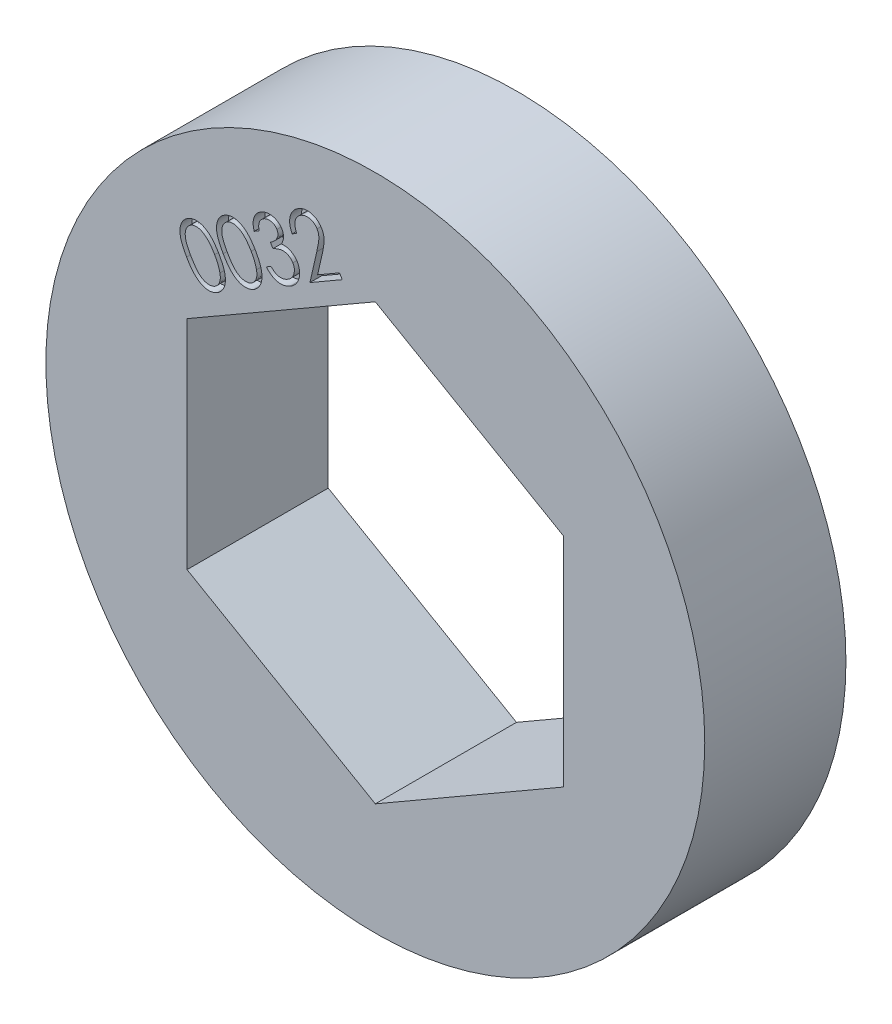
from build123d import *

# Parameters (mm, degrees)
SKETCH2_R           = 11.1125
BOSS_EXTRUDE1_DEPTH = 4.7625
CUT_EXTRUDE1_DEPTH  = 0.4


with BuildPart() as part:
    # Sketch2 → Boss-Extrude1 (new body)
    with BuildSketch(Plane.XY):
        Circle(SKETCH2_R)
        Polygon((0, 7.332348419), (-6.35, 3.666174209), (-6.35, -3.666174209), (0, -7.332348419), (6.35, -3.666174209), (6.35, 3.666174209), align=None, mode=Mode.SUBTRACT)
    extrude(amount=BOSS_EXTRUDE1_DEPTH)

    # Sketch3 → Cut-Extrude1 (cut)
    # profile 1 of 4: a face of its own
    with BuildSketch(Plane.XY.offset(4.7625)):
        with BuildLine():
            add(Edge.make_bspline(
                [(-6.365038057, 5.458747406), (-6.379698789, 5.484490177), (-6.408211771, 5.534556105), (-6.446592929, 5.609228243), (-6.480949907, 5.68034481), (-6.510333699, 5.748279394), (-6.53501277, 5.812851904), (-6.554677632, 5.874195773), (-6.570263658, 5.932186901), (-6.580650181, 5.987409018), (-6.587031451, 6.040226978), (-6.589883206, 6.091025858), (-6.590251775, 6.140247041), (-6.5862527, 6.187820314), (-6.579862116, 6.233886314), (-6.569584367, 6.278202446), (-6.556870702, 6.321190777), (-6.539853239, 6.362121922), (-6.520941172, 6.401609136), (-6.498212363, 6.438312776), (-6.474038026, 6.473396074), (-6.446649211, 6.505623608), (-6.417302653, 6.536073865), (-6.384881, 6.563653045), (-6.350350931, 6.58960647), (-6.325598958, 6.604629946), (-6.313096617, 6.612218376)],
                knots=[0, 0, 0, 0, 1.642146609, 3.193735178, 4.65339879, 6.019959045, 7.29583452, 8.483997703, 9.589852514, 10.622536898, 11.596230804, 12.537100014, 13.442089292, 14.322328697, 15.181380451, 16.017978509, 16.842123126, 17.663296608, 18.472766854, 19.266433458, 20.053886789, 20.832515994, 21.608242113, 22.395755133, 23.189688203, 24, 24, 24, 24], degree=3))
            add(Edge.make_bspline(
                [(-6.313096617, 6.612218376), (-6.300097298, 6.619365468), (-6.274326322, 6.633534481), (-6.23397143, 6.650766042), (-6.193326492, 6.665469162), (-6.151701903, 6.676247132), (-6.109513542, 6.683629142), (-6.066470373, 6.687750339), (-6.022804653, 6.688465055), (-5.978543644, 6.685784838), (-5.933933581, 6.680049518), (-5.889301853, 6.66985018), (-5.84476871, 6.655930609), (-5.799874868, 6.63905645), (-5.755627387, 6.617258167), (-5.711184044, 6.592207272), (-5.666610407, 6.563776491), (-5.622441137, 6.530812514), (-5.577768702, 6.493896836), (-5.53356611, 6.451592863), (-5.489168276, 6.404207544), (-5.445241241, 6.351562941), (-5.401451118, 6.293680762), (-5.357136675, 6.231069516), (-5.313596099, 6.162740436), (-5.285383039, 6.115024216), (-5.270928732, 6.090577918)],
                knots=[0, 0, 0, 0, 0.816106898, 1.617920902, 2.412419145, 3.193416184, 3.981325097, 4.767762218, 5.571164061, 6.382658378, 7.20678923, 8.044113261, 8.898964452, 9.773829128, 10.681145665, 11.610813622, 12.5814274, 13.588962241, 14.6427423, 15.769503862, 16.954284862, 18.215513191, 19.541650863, 20.948716096, 22.436745513, 24, 24, 24, 24], degree=3))
            add(Edge.make_bspline(
                [(-5.270928732, 6.090577918), (-5.25707176, 6.065915876), (-5.23004658, 6.017817628), (-5.192689344, 5.946281157), (-5.160601326, 5.876935245), (-5.13243293, 5.810349123), (-5.109140209, 5.746296723), (-5.089928789, 5.684824066), (-5.07541137, 5.625850623), (-5.06520092, 5.569207613), (-5.059520484, 5.514633712), (-5.056143047, 5.462127843), (-5.057185174, 5.411320239), (-5.06052418, 5.362177574), (-5.068189063, 5.314746736), (-5.078408548, 5.268924072), (-5.092166239, 5.22498129), (-5.109350663, 5.183006367), (-5.129214612, 5.143001122), (-5.152176902, 5.105420305), (-5.176830031, 5.069687586), (-5.20436922, 5.036387792), (-5.235136101, 5.00611551), (-5.267613267, 4.977453804), (-5.30276385, 4.951112706), (-5.327926897, 4.935907949), (-5.340678665, 4.928202701)],
                knots=[0, 0, 0, 0, 1.558572261, 3.039675171, 4.44500239, 5.767404933, 7.021920233, 8.19867626, 9.314183841, 10.366093107, 11.366862767, 12.335955634, 13.262731656, 14.164729598, 15.047477431, 15.907015182, 16.749641984, 17.580952634, 18.403702246, 19.207672054, 20.005351578, 20.794016824, 21.584181799, 22.380929523, 23.179510693, 24, 24, 24, 24], degree=3))
            add(Edge.make_bspline(
                [(-5.340678665, 4.928202701), (-5.353450941, 4.921228662), (-5.378811455, 4.907381074), (-5.418140238, 4.889797882), (-5.458489412, 4.876250404), (-5.499180344, 4.865203268), (-5.540711953, 4.858379189), (-5.582723678, 4.854122268), (-5.625524017, 4.85349799), (-5.668849188, 4.855933227), (-5.712337481, 4.862491203), (-5.755901049, 4.871852543), (-5.799011398, 4.885995088), (-5.842241936, 4.902982739), (-5.885331832, 4.923931061), (-5.928393753, 4.948383307), (-5.971118946, 4.976853692), (-6.01416687, 5.008800721), (-6.056934948, 5.045876579), (-6.100190117, 5.088094615), (-6.143832071, 5.135874962), (-6.187535896, 5.189568622), (-6.231810488, 5.24867481), (-6.276002699, 5.313640809), (-6.321208909, 5.383863572), (-6.35013384, 5.433282962), (-6.365038057, 5.458747406)],
                knots=[0, 0, 0, 0, 0.807491903, 1.603348545, 2.386916451, 3.167713854, 3.940658363, 4.719915701, 5.50935356, 6.313835313, 7.125313705, 7.947948844, 8.783651521, 9.640150085, 10.524255013, 11.440287308, 12.386399569, 13.372019105, 14.413529699, 15.525036669, 16.724996316, 18.002813491, 19.365932914, 20.822335035, 22.362637201, 24, 24, 24, 24], degree=3))
        make_face()
        with BuildLine():
            add(Edge.make_bspline(
                [(-6.21181081, 5.54296674), (-6.199079098, 5.521122802), (-6.174424939, 5.478823391), (-6.136470115, 5.418624931), (-6.099367985, 5.363399364), (-6.063558254, 5.312806176), (-6.028370312, 5.267414065), (-5.993769548, 5.227333857), (-5.960445007, 5.191810531), (-5.927565377, 5.161110332), (-5.894877722, 5.134462318), (-5.862204741, 5.110972915), (-5.829189361, 5.090593286), (-5.796127314, 5.073032865), (-5.762751479, 5.058456392), (-5.729238082, 5.046438628), (-5.695243314, 5.038067421), (-5.650721819, 5.030093628), (-5.596050388, 5.027040599), (-5.532876849, 5.033351819), (-5.47309286, 5.048946021), (-5.436988857, 5.06739506), (-5.418961835, 5.076606814)],
                knots=[0, 0, 0, 0, 1.475228016, 2.856686104, 4.15161897, 5.357081144, 6.47289893, 7.501387829, 8.445726694, 9.313720896, 10.124066195, 10.905058304, 11.660046733, 12.386348828, 13.08755313, 13.783651734, 14.460982071, 15.127735434, 16.421461315, 17.639985157, 18.821625413, 20, 20, 20, 20], degree=3))
            add(Edge.make_bspline(
                [(-5.418961835, 5.076606814), (-5.401787224, 5.087490039), (-5.367499785, 5.109217337), (-5.324384611, 5.153177119), (-5.28750399, 5.203791251), (-5.26330903, 5.251761961), (-5.248158036, 5.293488661), (-5.238848245, 5.326563085), (-5.232591636, 5.361223319), (-5.228775988, 5.397066868), (-5.228372046, 5.434519774), (-5.229588137, 5.473202324), (-5.234249909, 5.513340415), (-5.23911909, 5.540270952), (-5.24161892, 5.554097049)],
                knots=[0, 0, 0, 0, 1.337971097, 2.671129108, 4.032665881, 5.459843453, 6.198285547, 6.96065115, 7.724239053, 8.5201198, 9.33645292, 10.194052936, 11.072829554, 12, 12, 12, 12], degree=3))
            add(Edge.make_bspline(
                [(-5.24161892, 5.554097049), (-5.24512131, 5.571459558), (-5.252249489, 5.606796309), (-5.26706931, 5.659808895), (-5.284488667, 5.71419699), (-5.305185373, 5.769532055), (-5.32924506, 5.82583949), (-5.355861301, 5.883366944), (-5.385917021, 5.942047086), (-5.408053692, 5.98096423), (-5.419332845, 6.00079343)],
                knots=[0, 0, 0, 0, 0.879876913, 1.790754508, 2.73331625, 3.717259664, 4.725112015, 5.77538776, 6.866507818, 8, 8, 8, 8], degree=3))
            add(Edge.make_bspline(
                [(-5.419332845, 6.00079343), (-5.430805174, 6.020426862), (-5.453251787, 6.058841387), (-5.48868481, 6.113514021), (-5.523423421, 6.165010961), (-5.558657333, 6.21258709), (-5.594315019, 6.256188054), (-5.62949714, 6.296606441), (-5.665137813, 6.332929955), (-5.700835951, 6.365717579), (-5.736450676, 6.394974985), (-5.771572592, 6.421131322), (-5.806783639, 6.443468053), (-5.841590459, 6.462958301), (-5.876391186, 6.478801895), (-5.910796289, 6.491684295), (-5.945069635, 6.501051447), (-5.989735785, 6.508665936), (-6.044082139, 6.511800158), (-6.106837724, 6.506077185), (-6.16604376, 6.490337068), (-6.20181271, 6.472128223), (-6.219602026, 6.463072242)],
                knots=[0, 0, 0, 0, 1.327522451, 2.597413504, 3.803087542, 4.954092809, 6.052504639, 7.091116491, 8.08170511, 9.022070092, 9.919800897, 10.771882377, 11.577119672, 12.352806521, 13.099205072, 13.807429758, 14.495830891, 15.170113202, 16.450227669, 17.661618134, 18.837030004, 20, 20, 20, 20], degree=3))
            add(Edge.make_bspline(
                [(-6.219602026, 6.463072242), (-6.236763634, 6.45204528), (-6.270965928, 6.430069053), (-6.314383768, 6.385962878), (-6.351595721, 6.33470668), (-6.375666394, 6.285819834), (-6.39167966, 6.243841508), (-6.400274132, 6.21028835), (-6.407116719, 6.17563749), (-6.411280087, 6.13953304), (-6.412046932, 6.102080315), (-6.411243894, 6.063390682), (-6.406735722, 6.023554749), (-6.400649596, 5.981971531), (-6.390785468, 5.938069409), (-6.376915503, 5.891268672), (-6.358887953, 5.841240121), (-6.337377341, 5.787711595), (-6.311677162, 5.731122289), (-6.282156788, 5.671156368), (-6.248954708, 5.607822223), (-6.224443925, 5.56502492), (-6.21181081, 5.54296674)],
                knots=[0, 0, 0, 0, 1.186584607, 2.364808541, 3.584028067, 4.867913378, 5.52979883, 6.201670858, 6.884946004, 7.589109066, 8.317961587, 9.068444384, 9.84432244, 10.65432116, 11.518850237, 12.466086659, 13.499587148, 14.619373863, 15.830028341, 17.123623296, 18.517485242, 20, 20, 20, 20], degree=3))
        make_face(mode=Mode.SUBTRACT)
    # profile 2 of 4: a face of its own
    with BuildSketch(Plane.XY.offset(4.7625)):
        with BuildLine():
            add(Edge.make_bspline(
                [(-5.131229429, 6.171087149), (-5.145890161, 6.196829921), (-5.174403143, 6.246895849), (-5.212784301, 6.321567986), (-5.247141278, 6.392684553), (-5.276525071, 6.460619137), (-5.301204142, 6.525191648), (-5.320869004, 6.586535516), (-5.33645503, 6.644526644), (-5.346841553, 6.699748762), (-5.353222823, 6.752566721), (-5.356074577, 6.803365602), (-5.356443146, 6.852586784), (-5.352444072, 6.900160057), (-5.346053488, 6.946226057), (-5.335775739, 6.99054219), (-5.323062074, 7.033530521), (-5.306044611, 7.074461666), (-5.287132544, 7.113948879), (-5.264403734, 7.150652519), (-5.240229398, 7.185735817), (-5.212840583, 7.217963351), (-5.183494025, 7.248413609), (-5.151072372, 7.275992788), (-5.116542303, 7.301946214), (-5.09179033, 7.31696969), (-5.079287989, 7.32455812)],
                knots=[0, 0, 0, 0, 1.642146609, 3.193735178, 4.65339879, 6.019959045, 7.29583452, 8.483997703, 9.589852514, 10.622536898, 11.596230804, 12.537100014, 13.442089292, 14.322328697, 15.181380451, 16.017978509, 16.842123126, 17.663296608, 18.472766854, 19.266433458, 20.053886789, 20.832515994, 21.608242113, 22.395755133, 23.189688203, 24, 24, 24, 24], degree=3))
            add(Edge.make_bspline(
                [(-5.079287989, 7.32455812), (-5.066288669, 7.331705212), (-5.040517694, 7.345874225), (-5.000162802, 7.363105785), (-4.959517864, 7.377808906), (-4.917893275, 7.388586876), (-4.875704914, 7.395968885), (-4.832661745, 7.400090083), (-4.788996024, 7.400804799), (-4.744735016, 7.398124581), (-4.700124953, 7.392389261), (-4.655493225, 7.382189923), (-4.610960082, 7.368270353), (-4.56606624, 7.351396193), (-4.521818759, 7.329597911), (-4.477375415, 7.304547015), (-4.432801779, 7.276116235), (-4.388632509, 7.243152257), (-4.343960074, 7.20623658), (-4.299757482, 7.163932607), (-4.255359648, 7.116547288), (-4.211432613, 7.063902685), (-4.167642489, 7.006020505), (-4.123328047, 6.94340926), (-4.07978747, 6.87508018), (-4.05157441, 6.82736396), (-4.037120104, 6.802917662)],
                knots=[0, 0, 0, 0, 0.816106898, 1.617920902, 2.412419145, 3.193416184, 3.981325097, 4.767762218, 5.571164061, 6.382658378, 7.20678923, 8.044113261, 8.898964452, 9.773829128, 10.681145665, 11.610813622, 12.5814274, 13.588962241, 14.6427423, 15.769503862, 16.954284862, 18.215513191, 19.541650863, 20.948716096, 22.436745513, 24, 24, 24, 24], degree=3))
            add(Edge.make_bspline(
                [(-4.037120104, 6.802917662), (-4.023263131, 6.77825562), (-3.996237952, 6.730157372), (-3.958880716, 6.658620901), (-3.926792697, 6.589274989), (-3.898624302, 6.522688866), (-3.875331581, 6.458636467), (-3.85612016, 6.39716381), (-3.841602742, 6.338190367), (-3.831392292, 6.281547356), (-3.825711856, 6.226973456), (-3.822334419, 6.174467587), (-3.823376546, 6.123659983), (-3.826715552, 6.074517318), (-3.834380435, 6.02708648), (-3.84459992, 5.981263816), (-3.858357611, 5.937321033), (-3.875542035, 5.89534611), (-3.895405984, 5.855340866), (-3.918368273, 5.817760048), (-3.943021403, 5.78202733), (-3.970560592, 5.748727536), (-4.001327473, 5.718455254), (-4.033804638, 5.689793547), (-4.068955222, 5.66345245), (-4.094118269, 5.648247693), (-4.106870037, 5.640542445)],
                knots=[0, 0, 0, 0, 1.558572261, 3.039675171, 4.44500239, 5.767404933, 7.021920233, 8.19867626, 9.314183841, 10.366093107, 11.366862767, 12.335955634, 13.262731656, 14.164729598, 15.047477431, 15.907015182, 16.749641984, 17.580952634, 18.403702246, 19.207672054, 20.005351578, 20.794016824, 21.584181799, 22.380929523, 23.179510693, 24, 24, 24, 24], degree=3))
            add(Edge.make_bspline(
                [(-4.106870037, 5.640542445), (-4.119642313, 5.633568406), (-4.145002826, 5.619720818), (-4.18433161, 5.602137626), (-4.224680784, 5.588590147), (-4.265371716, 5.577543011), (-4.306903325, 5.570718933), (-4.34891505, 5.566462012), (-4.391715389, 5.565837734), (-4.43504056, 5.568272971), (-4.478528853, 5.574830947), (-4.52209242, 5.584192287), (-4.56520277, 5.598334832), (-4.608433308, 5.615322483), (-4.651523204, 5.636270805), (-4.694585125, 5.66072305), (-4.737310318, 5.689193436), (-4.780358242, 5.721140465), (-4.82312632, 5.758216322), (-4.866381489, 5.800434359), (-4.910023443, 5.848214706), (-4.953727267, 5.901908365), (-4.998001859, 5.961014553), (-5.042194071, 6.025980553), (-5.087400281, 6.096203316), (-5.116325212, 6.145622706), (-5.131229429, 6.171087149)],
                knots=[0, 0, 0, 0, 0.807491903, 1.603348545, 2.386916451, 3.167713854, 3.940658363, 4.719915701, 5.50935356, 6.313835313, 7.125313705, 7.947948844, 8.783651521, 9.640150085, 10.524255013, 11.440287308, 12.386399569, 13.372019105, 14.413529699, 15.525036669, 16.724996316, 18.002813491, 19.365932914, 20.822335035, 22.362637201, 24, 24, 24, 24], degree=3))
        make_face()
        with BuildLine():
            add(Edge.make_bspline(
                [(-4.978002182, 6.255306484), (-4.965270469, 6.233462545), (-4.940616311, 6.191163134), (-4.902661486, 6.130964675), (-4.865559357, 6.075739108), (-4.829749626, 6.02514592), (-4.794561683, 5.979753809), (-4.75996092, 5.939673601), (-4.726636379, 5.904150274), (-4.693756749, 5.873450076), (-4.661069094, 5.846802062), (-4.628396113, 5.823312659), (-4.595380733, 5.802933029), (-4.562318686, 5.785372609), (-4.528942851, 5.770796135), (-4.495429454, 5.758778371), (-4.461434686, 5.750407165), (-4.416913191, 5.742433372), (-4.36224176, 5.739380342), (-4.299068221, 5.745691563), (-4.239284232, 5.761285765), (-4.203180229, 5.779734803), (-4.185153207, 5.788946558)],
                knots=[0, 0, 0, 0, 1.475228016, 2.856686104, 4.15161897, 5.357081144, 6.47289893, 7.501387829, 8.445726694, 9.313720896, 10.124066195, 10.905058304, 11.660046733, 12.386348828, 13.08755313, 13.783651734, 14.460982071, 15.127735434, 16.421461315, 17.639985157, 18.821625413, 20, 20, 20, 20], degree=3))
            add(Edge.make_bspline(
                [(-4.185153207, 5.788946558), (-4.167978596, 5.799829782), (-4.133691157, 5.821557081), (-4.090575983, 5.865516863), (-4.053695362, 5.916130995), (-4.029500402, 5.964101704), (-4.014349408, 6.005828404), (-4.005039617, 6.038902828), (-3.998783008, 6.073563062), (-3.99496736, 6.109406611), (-3.994563418, 6.146859517), (-3.995779508, 6.185542068), (-4.000441281, 6.225680159), (-4.005310462, 6.252610696), (-4.007810292, 6.266436792)],
                knots=[0, 0, 0, 0, 1.337971097, 2.671129108, 4.032665881, 5.459843453, 6.198285547, 6.96065115, 7.724239053, 8.5201198, 9.33645292, 10.194052936, 11.072829554, 12, 12, 12, 12], degree=3))
            add(Edge.make_bspline(
                [(-4.007810292, 6.266436792), (-4.011312682, 6.283799301), (-4.018440861, 6.319136053), (-4.033260682, 6.372148639), (-4.050680039, 6.426536733), (-4.071376745, 6.481871799), (-4.095436432, 6.538179234), (-4.122052673, 6.595706688), (-4.152108393, 6.654386829), (-4.174245064, 6.693303974), (-4.185524217, 6.713133173)],
                knots=[0, 0, 0, 0, 0.879876913, 1.790754508, 2.73331625, 3.717259664, 4.725112015, 5.77538776, 6.866507818, 8, 8, 8, 8], degree=3))
            add(Edge.make_bspline(
                [(-4.185524217, 6.713133173), (-4.196996546, 6.732766606), (-4.219443158, 6.771181131), (-4.254876182, 6.825853764), (-4.289614793, 6.877350705), (-4.324848705, 6.924926834), (-4.360506391, 6.968527798), (-4.395688512, 7.008946184), (-4.431329185, 7.045269699), (-4.467027322, 7.078057322), (-4.502642048, 7.107314728), (-4.537763963, 7.133471065), (-4.57297501, 7.155807796), (-4.607781831, 7.175298044), (-4.642582558, 7.191141639), (-4.676987661, 7.204024038), (-4.711261007, 7.213391191), (-4.755927157, 7.22100568), (-4.810273511, 7.224139902), (-4.873029096, 7.218416928), (-4.932235132, 7.202676812), (-4.968004081, 7.184467967), (-4.985793398, 7.175411986)],
                knots=[0, 0, 0, 0, 1.327522451, 2.597413504, 3.803087542, 4.954092809, 6.052504639, 7.091116491, 8.08170511, 9.022070092, 9.919800897, 10.771882377, 11.577119672, 12.352806521, 13.099205072, 13.807429758, 14.495830891, 15.170113202, 16.450227669, 17.661618134, 18.837030004, 20, 20, 20, 20], degree=3))
            add(Edge.make_bspline(
                [(-4.985793398, 7.175411986), (-5.002955005, 7.164385024), (-5.0371573, 7.142408796), (-5.08057514, 7.098302622), (-5.117787093, 7.047046423), (-5.141857766, 6.998159577), (-5.157871032, 6.956181251), (-5.166465504, 6.922628093), (-5.173308091, 6.887977233), (-5.177471459, 6.851872783), (-5.178238304, 6.814420059), (-5.177435266, 6.775730426), (-5.172927093, 6.735894492), (-5.166840968, 6.694311274), (-5.15697684, 6.650409153), (-5.143106875, 6.603608415), (-5.125079325, 6.553579865), (-5.103568713, 6.500051339), (-5.077868534, 6.443462033), (-5.04834816, 6.383496111), (-5.01514608, 6.320161967), (-4.990635297, 6.277364663), (-4.978002182, 6.255306484)],
                knots=[0, 0, 0, 0, 1.186584607, 2.364808541, 3.584028067, 4.867913378, 5.52979883, 6.201670858, 6.884946004, 7.589109066, 8.317961587, 9.068444384, 9.84432244, 10.65432116, 11.518850237, 12.466086659, 13.499587148, 14.619373863, 15.830028341, 17.123623296, 18.517485242, 20, 20, 20, 20], degree=3))
        make_face(mode=Mode.SUBTRACT)
    # profile 3 of 4: a face of its own
    with BuildSketch(Plane.XY.offset(4.7625)):
        with BuildLine():
            Line((-3.921536469, 7.443652421), (-4.085152004, 7.349044798))
            add(Edge.make_bspline(
                [(-4.085152004, 7.349044798), (-4.090485084, 7.367405392), (-4.100961864, 7.403474588), (-4.111907579, 7.457694086), (-4.119305718, 7.510476969), (-4.121601958, 7.561848626), (-4.121043165, 7.611785962), (-4.114604819, 7.660240406), (-4.105342673, 7.707551518), (-4.090965914, 7.753122002), (-4.073396047, 7.796958502), (-4.051639865, 7.83810018), (-4.027122339, 7.87716258), (-3.998795566, 7.913340604), (-3.967556287, 7.94752795), (-3.932486057, 7.978476099), (-3.89443136, 8.007509223), (-3.866912852, 8.024277711), (-3.852899567, 8.03281675)],
                knots=[0, 0, 0, 0, 1.167122436, 2.292799985, 3.374788507, 4.418350268, 5.430616342, 6.419827689, 7.398867449, 8.371125697, 9.333210978, 10.279063296, 11.209319313, 12.145930279, 13.081231023, 14.033304242, 14.998496994, 16, 16, 16, 16], degree=3))
            add(Edge.make_bspline(
                [(-3.852899567, 8.03281675), (-3.832014619, 8.044029042), (-3.790629926, 8.066246827), (-3.724273581, 8.089258788), (-3.656237051, 8.104906671), (-3.586781076, 8.111223986), (-3.518004199, 8.110102302), (-3.451483222, 8.10002082), (-3.38826048, 8.081416727), (-3.329079214, 8.054305063), (-3.275071162, 8.020272212), (-3.227197001, 7.980644678), (-3.185381303, 7.936022044), (-3.163910288, 7.901863757), (-3.153174173, 7.884783647)],
                knots=[0, 0, 0, 0, 1.074691264, 2.12956096, 3.177038176, 4.237422126, 5.287604453, 6.29289588, 7.282431617, 8.269862499, 9.238778467, 10.171894397, 11.085895465, 12, 12, 12, 12], degree=3))
            add(Edge.make_bspline(
                [(-3.153174173, 7.884783647), (-3.143986692, 7.867583853), (-3.125940342, 7.833799457), (-3.108318596, 7.779720302), (-3.098044565, 7.724842364), (-3.095668127, 7.668817131), (-3.102356666, 7.611897737), (-3.116888468, 7.554203649), (-3.138627113, 7.495237154), (-3.158999737, 7.457278157), (-3.169498625, 7.437716256)],
                knots=[0, 0, 0, 0, 0.993684363, 1.951827249, 2.889052743, 3.836657995, 4.80211292, 5.803367142, 6.867980745, 8, 8, 8, 8], degree=3))
            add(Edge.make_bspline(
                [(-3.169498625, 7.437716256), (-3.146149731, 7.440154296), (-3.1001245, 7.444960149), (-3.031318946, 7.442003808), (-2.964291099, 7.431399175), (-2.921752567, 7.417052658), (-2.90051617, 7.409890485)],
                knots=[0, 0, 0, 0, 1.030179289, 2.030684612, 3.016863995, 4, 4, 4, 4], degree=3))
            add(Edge.make_bspline(
                [(-2.90051617, 7.409890485), (-2.886055666, 7.404083854), (-2.857470036, 7.392605263), (-2.817052871, 7.371169752), (-2.778941947, 7.347463208), (-2.743592662, 7.320730108), (-2.711239944, 7.290960886), (-2.68179223, 7.258266576), (-2.654391267, 7.223203619), (-2.638947889, 7.197596226), (-2.631162704, 7.184687243)],
                knots=[0, 0, 0, 0, 1.043009504, 2.061828929, 3.059211452, 4.046535033, 5.025484809, 5.998847267, 6.991195781, 8, 8, 8, 8], degree=3))
            add(Edge.make_bspline(
                [(-2.631162704, 7.184687243), (-2.618967332, 7.161619769), (-2.594688417, 7.115696346), (-2.570567111, 7.041098146), (-2.555319479, 6.963380981), (-2.552042083, 6.896431162), (-2.553889328, 6.842401879), (-2.55802154, 6.802251292), (-2.564547267, 6.762765665), (-2.574410608, 6.724322979), (-2.586184016, 6.686397617), (-2.601151566, 6.6495927), (-2.618162633, 6.613234334), (-2.644988094, 6.566480251), (-2.683985306, 6.510756471), (-2.74003135, 6.450244767), (-2.804304604, 6.395418941), (-2.852839304, 6.365496953), (-2.877513532, 6.350285116)],
                knots=[0, 0, 0, 0, 1.29000945, 2.568189731, 3.865360559, 5.202453644, 5.87655905, 6.541392666, 7.199849175, 7.856366189, 8.505211772, 9.164806495, 9.822265449, 10.491484855, 11.832065632, 13.180012139, 14.566365457, 16, 16, 16, 16], degree=3))
            add(Edge.make_bspline(
                [(-2.877513532, 6.350285116), (-2.894680918, 6.340842699), (-2.928261449, 6.322372713), (-2.980334158, 6.300026773), (-3.032216262, 6.282606708), (-3.084155817, 6.269648014), (-3.136255638, 6.262344113), (-3.18828424, 6.259699498), (-3.240352459, 6.261885327), (-3.292182948, 6.269308493), (-3.343640661, 6.281980853), (-3.394110522, 6.299965549), (-3.443861576, 6.322562544), (-3.492180933, 6.351176919), (-3.539762816, 6.384589514), (-3.586178005, 6.423414771), (-3.631647438, 6.467351711), (-3.660188799, 6.499600853), (-3.674814631, 6.516126713)],
                knots=[0, 0, 0, 0, 1.049948212, 2.053767481, 3.032934156, 3.981728119, 4.919406159, 5.848819654, 6.771301382, 7.708979423, 8.651334191, 9.607581917, 10.577750219, 11.57619022, 12.613670697, 13.691816969, 14.817186887, 16, 16, 16, 16], degree=3))
            Line((-3.674814631, 6.516126713), (-3.517877281, 6.607024232))
            add(Edge.make_bspline(
                [(-3.517877281, 6.607024232), (-3.507057864, 6.596571804), (-3.486031429, 6.576258574), (-3.454313618, 6.547691181), (-3.422154236, 6.523492896), (-3.39114989, 6.50148186), (-3.359920795, 6.483812519), (-3.329275661, 6.469272361), (-3.299310123, 6.457285986), (-3.278894878, 6.452448334), (-3.268929381, 6.450086882)],
                knots=[0, 0, 0, 0, 1.210652835, 2.352780436, 3.431589675, 4.447423396, 5.410202577, 6.313818959, 7.176907658, 8, 8, 8, 8], degree=3))
            add(Edge.make_bspline(
                [(-3.268929381, 6.450086882), (-3.256472095, 6.447845324), (-3.231567654, 6.443364031), (-3.19375134, 6.441376711), (-3.155701439, 6.442698904), (-3.11775486, 6.448530653), (-3.079402433, 6.457302149), (-3.041360111, 6.470638818), (-3.002766353, 6.4867117), (-2.978055493, 6.500536991), (-2.965442969, 6.507593476)],
                knots=[0, 0, 0, 0, 0.960250092, 1.919719324, 2.868886039, 3.84629253, 4.830262792, 5.851782114, 6.90354087, 8, 8, 8, 8], degree=3))
            add(Edge.make_bspline(
                [(-2.965442969, 6.507593476), (-2.951422516, 6.515995177), (-2.923984097, 6.532437539), (-2.886411131, 6.560994069), (-2.852510546, 6.591165896), (-2.823105634, 6.623851182), (-2.797070011, 6.657902983), (-2.776070523, 6.694665524), (-2.758319926, 6.733039659), (-2.745165355, 6.773314498), (-2.736144668, 6.814117324), (-2.730235567, 6.854551591), (-2.728946796, 6.894198565), (-2.730843213, 6.933166286), (-2.737848298, 6.971150423), (-2.748164334, 7.008493571), (-2.7626958, 7.04502891), (-2.775134989, 7.068300612), (-2.781421869, 7.080062343)],
                knots=[0, 0, 0, 0, 1.167772066, 2.285362462, 3.368423776, 4.407462857, 5.424256643, 6.426647963, 7.427673547, 8.442620435, 9.448631702, 10.412699789, 11.359420925, 12.280485196, 13.196272094, 14.114446078, 15.047023836, 16, 16, 16, 16], degree=3))
            add(Edge.make_bspline(
                [(-2.781421869, 7.080062343), (-2.791007931, 7.095098247), (-2.810068147, 7.124994523), (-2.846431143, 7.164270133), (-2.888253583, 7.19828182), (-2.93536113, 7.226251478), (-2.985838371, 7.24802665), (-3.038699725, 7.262991775), (-3.093401785, 7.268983271), (-3.140107211, 7.268126411), (-3.179108834, 7.263238632), (-3.211085247, 7.256419034), (-3.245379312, 7.24654617), (-3.282374668, 7.234748637), (-3.321697459, 7.219762234), (-3.36345885, 7.201918919), (-3.407720582, 7.181437615), (-3.437776834, 7.166461799), (-3.453321492, 7.158716523)],
                knots=[0, 0, 0, 0, 1.125332271, 2.237527227, 3.365652799, 4.522661347, 5.688745643, 6.832392968, 7.981451294, 9.154302826, 9.776809218, 10.4636777, 11.218577585, 12.031930245, 12.917616271, 13.877381006, 14.902212215, 16, 16, 16, 16], degree=3))
            Line((-3.453321492, 7.158716523), (-3.538282847, 7.306007606))
            add(Edge.make_bspline(
                [(-3.538282847, 7.306007606), (-3.52065904, 7.316978158), (-3.486041287, 7.338527186), (-3.43818984, 7.375129048), (-3.396559022, 7.416096335), (-3.359981771, 7.459058023), (-3.329585732, 7.503274403), (-3.307044781, 7.54787966), (-3.291644577, 7.591502211), (-3.284635951, 7.63443809), (-3.284073091, 7.675898958), (-3.290353833, 7.715696351), (-3.301506602, 7.754105258), (-3.313898665, 7.777614622), (-3.3201288, 7.789434004)],
                knots=[0, 0, 0, 0, 1.266180123, 2.487108066, 3.66629058, 4.822683044, 5.925529858, 6.931065459, 7.864004537, 8.736007996, 9.57354566, 10.382383672, 11.186739966, 12, 12, 12, 12], degree=3))
            add(Edge.make_bspline(
                [(-3.3201288, 7.789434004), (-3.325409574, 7.797830645), (-3.335845099, 7.814423545), (-3.354212279, 7.837229864), (-3.374603817, 7.857632028), (-3.397036475, 7.875695393), (-3.421810676, 7.890920095), (-3.448668853, 7.903925088), (-3.477591, 7.914702866), (-3.508316309, 7.922696646), (-3.539926194, 7.928369539), (-3.572025321, 7.930663235), (-3.60403601, 7.929244579), (-3.636188157, 7.925906895), (-3.668035196, 7.918176717), (-3.699954177, 7.907714155), (-3.731832292, 7.893979556), (-3.752562812, 7.882722505), (-3.763115078, 7.876992431)],
                knots=[0, 0, 0, 0, 0.946865682, 1.871134866, 2.789952873, 3.69761661, 4.615446926, 5.561132897, 6.544151416, 7.558468937, 8.589704286, 9.608072091, 10.624588379, 11.647331576, 12.690339784, 13.747500356, 14.853430691, 16, 16, 16, 16], degree=3))
            add(Edge.make_bspline(
                [(-3.763115078, 7.876992431), (-3.779424198, 7.86659894), (-3.811324371, 7.846269567), (-3.852421147, 7.807936266), (-3.88488659, 7.763781888), (-3.906053026, 7.723325364), (-3.91842831, 7.688175906), (-3.925405945, 7.659462897), (-3.930216385, 7.628557355), (-3.932567232, 7.595564859), (-3.933562411, 7.560498626), (-3.93129579, 7.523363482), (-3.927835604, 7.484083062), (-3.923672216, 7.45736059), (-3.921536469, 7.443652421)],
                knots=[0, 0, 0, 0, 1.400382439, 2.739108122, 4.046622513, 5.35815942, 6.033190176, 6.744421047, 7.497821892, 8.298419774, 9.141582518, 10.039481475, 10.994287596, 12, 12, 12, 12], degree=3))
        make_face()
    # profile 4 of 4: a face of its own
    with BuildSketch(Plane.XY.offset(4.7625)):
        with BuildLine():
            Line((-2.649513782, 8.003877948), (-2.803112039, 7.91520649))
            add(Edge.make_bspline(
                [(-2.803112039, 7.91520649), (-2.813405397, 7.935058069), (-2.833654545, 7.974110198), (-2.856670091, 8.034828281), (-2.874619433, 8.095265643), (-2.885602747, 8.15585938), (-2.890942589, 8.216353686), (-2.890142697, 8.276750441), (-2.883517011, 8.337183042), (-2.870468289, 8.39690883), (-2.852038377, 8.454907714), (-2.828547503, 8.510046857), (-2.80049981, 8.562116659), (-2.76624156, 8.609881117), (-2.728071164, 8.654922902), (-2.684177547, 8.695652519), (-2.63583554, 8.733617546), (-2.600406016, 8.755273957), (-2.582360921, 8.76630408)],
                knots=[0, 0, 0, 0, 1.095282936, 2.154646258, 3.17720595, 4.181928296, 5.167652369, 6.149790891, 7.137898102, 8.142620448, 9.141473397, 10.116570871, 11.076934142, 12.033943277, 12.992621363, 13.966134661, 14.964104222, 16, 16, 16, 16], degree=3))
            add(Edge.make_bspline(
                [(-2.582360921, 8.76630408), (-2.564104957, 8.77629533), (-2.528330819, 8.795874048), (-2.472729644, 8.818862106), (-2.417348084, 8.836047618), (-2.361947242, 8.847518104), (-2.306546991, 8.852214119), (-2.251324399, 8.851159069), (-2.196223616, 8.843993627), (-2.141907733, 8.830911988), (-2.089017906, 8.813405291), (-2.039213731, 8.790778312), (-1.992096824, 8.765139542), (-1.949040443, 8.734316001), (-1.908998983, 8.70009612), (-1.872426102, 8.661586233), (-1.839308983, 8.618888341), (-1.82027395, 8.587911711), (-1.810659532, 8.572265702)],
                knots=[0, 0, 0, 0, 1.123370733, 2.201342023, 3.242939719, 4.25161303, 5.250641824, 6.239413307, 7.22946995, 8.24530558, 9.252850335, 10.23353436, 11.19631197, 12.14517952, 13.087748971, 14.037392037, 15.008704871, 16, 16, 16, 16], degree=3))
            add(Edge.make_bspline(
                [(-1.810659532, 8.572265702), (-1.798589479, 8.549404991), (-1.77461951, 8.504005809), (-1.74884262, 8.431431752), (-1.7335135, 8.356129998), (-1.727610799, 8.29114938), (-1.728419, 8.235846924), (-1.731052962, 8.189310681), (-1.736040182, 8.137848614), (-1.743048777, 8.081532561), (-1.752747145, 8.020292108), (-1.765341809, 7.95422886), (-1.779065851, 7.88310608), (-1.790114732, 7.834297013), (-1.79581912, 7.809097549)],
                knots=[0, 0, 0, 0, 1.186888703, 2.357047186, 3.523999674, 4.710480142, 5.347000729, 6.064162024, 6.851887177, 7.722424512, 8.671688502, 9.700498606, 10.812798412, 12, 12, 12, 12], degree=3))
            Line((-1.79581912, 7.809097549), (-1.946078285, 7.148328235))
            Line((-1.946078285, 7.148328235), (-1.20591277, 7.575732081))
            Line((-1.20591277, 7.575732081), (-1.116499292, 7.421020793))
            Line((-1.116499292, 7.421020793), (-2.205414473, 6.792158363))
            Line((-2.205414473, 6.792158363), (-1.975017087, 7.807613508))
            add(Edge.make_bspline(
                [(-1.975017087, 7.807613508), (-1.969372357, 7.832206236), (-1.958496749, 7.879588637), (-1.944131496, 7.948008894), (-1.931736548, 8.010935796), (-1.921688899, 8.068206447), (-1.913977039, 8.119939777), (-1.907661635, 8.16601648), (-1.904354528, 8.206645484), (-1.902695977, 8.252966954), (-1.905660442, 8.306273655), (-1.917390018, 8.36702728), (-1.935867183, 8.425471628), (-1.955022997, 8.461217254), (-1.964628799, 8.479142121)],
                knots=[0, 0, 0, 0, 1.319013454, 2.541321333, 3.654536807, 4.671697523, 5.58052685, 6.388829791, 7.102353416, 7.71037053, 8.811316192, 9.883995718, 10.938916503, 12, 12, 12, 12], degree=3))
            add(Edge.make_bspline(
                [(-1.964628799, 8.479142121), (-1.971356586, 8.490032578), (-1.984614428, 8.511493418), (-2.007785681, 8.541173709), (-2.033892252, 8.567273039), (-2.061890168, 8.591198428), (-2.092843317, 8.61137661), (-2.125983041, 8.62913815), (-2.161996253, 8.64299339), (-2.199621492, 8.654527577), (-2.238534937, 8.66224209), (-2.277407176, 8.666339052), (-2.316057696, 8.666814757), (-2.354271899, 8.66317248), (-2.392040502, 8.655002322), (-2.429667936, 8.644044477), (-2.467003793, 8.628791376), (-2.490842345, 8.615668806), (-2.50296472, 8.60899572)],
                knots=[0, 0, 0, 0, 0.997168774, 1.965030432, 2.925957377, 3.869964327, 4.829585434, 5.799604023, 6.794674719, 7.831348259, 8.863352075, 9.880853097, 10.873587394, 11.87094245, 12.865172675, 13.880617629, 14.922252107, 16, 16, 16, 16], degree=3))
            add(Edge.make_bspline(
                [(-2.50296472, 8.60899572), (-2.515377591, 8.60145235), (-2.53970286, 8.586669753), (-2.572814454, 8.560564718), (-2.603089913, 8.533091239), (-2.62925948, 8.502451298), (-2.652263373, 8.469992927), (-2.671800608, 8.435046673), (-2.687660904, 8.397819547), (-2.700372367, 8.358632623), (-2.708810951, 8.317702706), (-2.713398429, 8.275700521), (-2.713184736, 8.232696412), (-2.709177876, 8.18870606), (-2.700394633, 8.143696937), (-2.68771849, 8.097701514), (-2.671041184, 8.050609083), (-2.656814465, 8.019726085), (-2.649513782, 8.003877948)],
                knots=[0, 0, 0, 0, 1.005170463, 1.969813475, 2.915404486, 3.832435459, 4.754533271, 5.667233306, 6.599657637, 7.553207593, 8.5158328, 9.489221553, 10.474299481, 11.489457431, 12.544489203, 13.645864792, 14.791935452, 16, 16, 16, 16], degree=3))
        make_face()
    extrude(amount=-CUT_EXTRUDE1_DEPTH, mode=Mode.SUBTRACT)


solid = part.part
